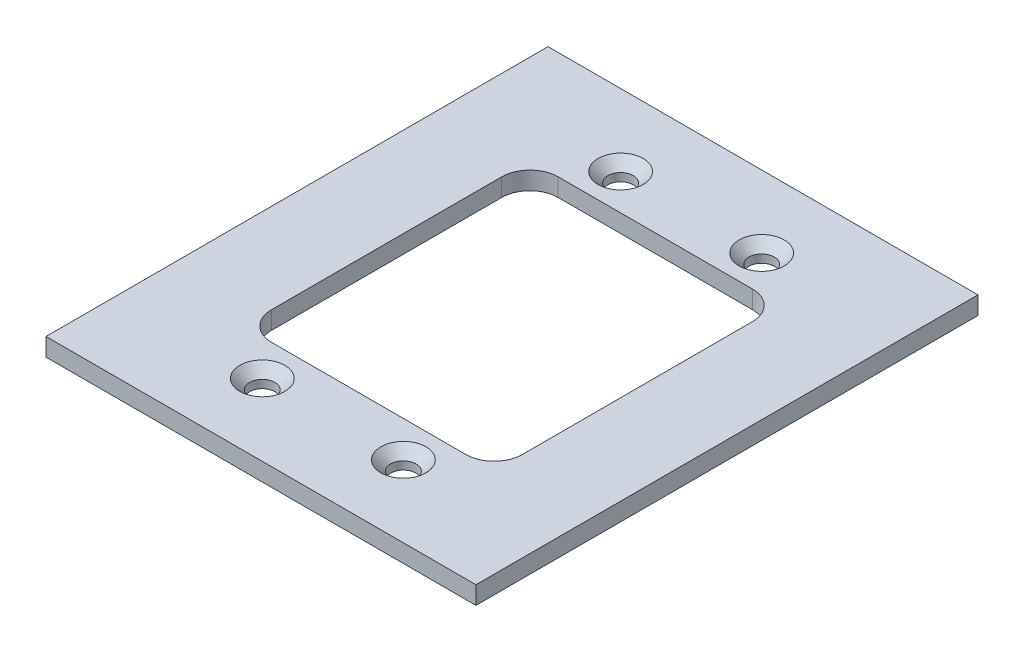
from build123d import *

# Parameters (mm, degrees)
SKETCH1_W           = 76.2
SKETCH1_H           = 88.978
SKETCH1_W_2         = 44.45
SKETCH1_H_2         = 50.8
BOSS_EXTRUDE1_DEPTH = 3.175
FILLET1_R           = 5


# Read off the part's stored shape, not the designer's step: AdvancedHole1
with BuildPart() as part:
    # Sketch1 → Boss-Extrude1 (new body)
    with BuildSketch(Plane(origin=(0, 0, 0), x_dir=(1, 0, 0), z_dir=(0, 1, 0))):
        Rectangle(SKETCH1_W, SKETCH1_H)
        Rectangle(SKETCH1_W_2, SKETCH1_H_2, mode=Mode.SUBTRACT)
    extrude(amount=BOSS_EXTRUDE1_DEPTH)

    # AdvancedHole1 outline → AdvancedHole1 (revolve, cut)
    with BuildSketch(Plane(origin=(12.5, 0, -31.75), x_dir=(1, 0, 0), z_dir=(0, 0, 1))):
        Polygon((4, 3.175), (0, 3.175), (0, 0), (2.25, 0), (2.25, 1.425), align=None)
    advancedhole1 = revolve(axis=Axis((12.5, 0, -31.75), (0, 1, 0)), mode=Mode.SUBTRACT)

    # AdvancedHole1 2 outline → AdvancedHole1 2 (revolve, cut)
    with BuildSketch(Plane(origin=(-12.5, 0, -31.75), x_dir=(1, 0, 0), z_dir=(0, 0, 1))):
        Polygon((4, 3.175), (0, 3.175), (0, 0), (2.25, 0), (2.25, 1.425), align=None)
    advancedhole1_2 = revolve(axis=Axis((-12.5, 0, -31.75), (0, 1, 0)), mode=Mode.SUBTRACT)

    # Mirror1: AdvancedHole1, AdvancedHole1 2 across plane
    add(advancedhole1.mirror(Plane.XY), mode=Mode.SUBTRACT)
    add(advancedhole1_2.mirror(Plane.XY), mode=Mode.SUBTRACT)

    # Fillet1
    fillet1_edges = [part.edges().sort_by_distance(p)[0] for p in [
        (-22.225, 1.5875, -25.4),
        (-22.225, 1.5875, 25.4),
        (22.225, 1.5875, 25.4),
        (22.225, 1.5875, -25.4),
    ]]
    fillet(fillet1_edges, radius=FILLET1_R)


solid = part.part
